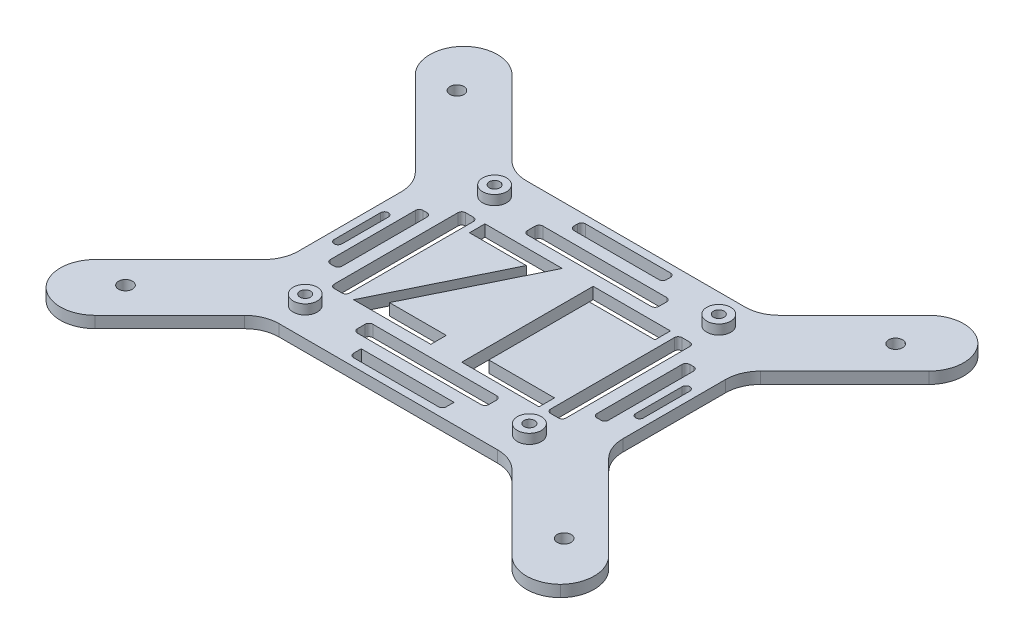
from build123d import *

# Parameters (mm, degrees)
SKETCH2_W           = 84
SKETCH2_H           = 64
BOSS_EXTRUDE1_DEPTH = 3
SKETCH3_R           = 3.1
BOSS_EXTRUDE2_DEPTH = 2.5
SKETCH4_R           = 1.375
CUT_EXTRUDE1_DEPTH  = 95.667806042
SKETCH5_R           = 1.8
CUT_EXTRUDE2_DEPTH  = 95.555504868
FILLET1_R           = 9
FILLET2_R           = 9
CUT_EXTRUDE3_DEPTH  = 90.310693627
SKETCH7_W           = 2
SKETCH7_H           = 14
SKETCH7_W_2         = 3
SKETCH7_H_2         = 24
SKETCH7_W_3         = 4
SKETCH7_H_3         = 34
SKETCH7_W_4         = 24
SKETCH7_H_4         = 3
SKETCH7_W_5         = 34
SKETCH7_H_5         = 4
CUT_EXTRUDE4_DEPTH  = 90.310693627
FILLET3_R           = 1


# Some blends are built 0.0001 mm under size
with BuildPart() as part:
    # Sketch2 → Boss-Extrude1 (new body)
    with BuildSketch(Plane(origin=(0, 0, 0), x_dir=(1, 0, 0), z_dir=(0, 1, 0))):
        Rectangle(SKETCH2_W, SKETCH2_H)
        Polygon((-42, -32), (-42, -17), (-72.784271247, -47.784271247), (-60.284271247, -60.284271247), (-32, -32), align=None)
        Polygon((60.284271247, 60.284271247), (32, 32), (42, 32), (42, 17), (72.784271247, 47.784271247), align=None)
        Polygon((72.784271247, -47.784271247), (42, -17), (42, -32), (32, -32), (60.284271247, -60.284271247), align=None)
        Polygon((-42, 32), (-32, 32), (-60.284271247, 60.284271247), (-72.784271247, 47.784271247), (-42, 17), align=None)
    extrude(amount=BOSS_EXTRUDE1_DEPTH)

    # Sketch3 → Boss-Extrude2 (add)
    with BuildSketch(Plane(origin=(0, 3, 0), x_dir=(1, 0, 0), z_dir=(0, 1, 0))):
        with Locations(Location((-29, 24.5, 0), (0, 0, 270))):
            Circle(SKETCH3_R)
        with Locations(Location((-29, -24.5, 0), (0, 0, 270))):
            Circle(SKETCH3_R)
        with Locations(Location((29, -24.5, 0), (0, 0, 270))):
            Circle(SKETCH3_R)
        with Locations(Location((29, 24.5, 0), (0, 0, 270))):
            Circle(SKETCH3_R)
    extrude(amount=BOSS_EXTRUDE2_DEPTH)

    # Sketch4 → Cut-Extrude1 (cut, through all)
    with BuildSketch(Plane(origin=(0, 5.5, 0), x_dir=(1, 0, 0), z_dir=(0, 1, 0))):
        with Locations(Location((-29, 24.5, 0), (0, 0, 270))):
            Circle(SKETCH4_R)
        with Locations(Location((-29, -24.5, 0), (0, 0, 270))):
            Circle(SKETCH4_R)
        with Locations(Location((29, -24.5, 0), (0, 0, 270))):
            Circle(SKETCH4_R)
        with Locations(Location((29, 24.5, 0), (0, 0, 270))):
            Circle(SKETCH4_R)
    extrude(amount=-CUT_EXTRUDE1_DEPTH, mode=Mode.SUBTRACT)

    # Sketch5 → Cut-Extrude2 (cut, through all)
    with BuildSketch(Plane(origin=(0, 3, 0), x_dir=(1, 0, 0), z_dir=(0, 1, 0))):
        with Locations(Location((-57.5, 43.25, 0), (0, 0, 270))):
            Circle(SKETCH5_R)
        with Locations(Location((56, 43.25, 0), (0, 0, 270))):
            Circle(SKETCH5_R)
        with Locations(Location((56.75, -43.25, 0), (0, 0, 270))):
            Circle(SKETCH5_R)
        with Locations(Location((-56.75, -43.25, 0), (0, 0, 270))):
            Circle(SKETCH5_R)
    extrude(amount=-CUT_EXTRUDE2_DEPTH, mode=Mode.SUBTRACT)

    # Fillet1
    # the kernel refuses this fillet: 9 mm, written as the material it takes off along each edge
    with BuildSketch(Plane(origin=(-72.784271247, -22.5, 47.784271247), x_dir=(0.7071067811865487, 0, 0.7071067811865464), z_dir=(0, 1, 0)), Plane(origin=(-60.284271247, -22.5, 60.284271247), x_dir=(0.7071067811865467, 0, -0.7071067811865483), z_dir=(0, 1, 0)), Plane(origin=(60.284271247, -22.5, 60.284271247), x_dir=(0.7071067811865482, 0, -0.7071067811865467), z_dir=(0, 1, 0)), Plane(origin=(72.784271247, -22.5, 47.784271247), x_dir=(-0.7071067811865468, 0, -0.7071067811865483), z_dir=(0, 1, 0))) as fillet1_piece_1:
        with BuildLine():
            CenterArc((FILLET1_R, FILLET1_R), FILLET1_R, 180, 90)
            Line((0, FILLET1_R), (0, 0))
            Line((0, 0), (FILLET1_R, 0))
        make_face()
    extrude(amount=48, mode=Mode.SUBTRACT)
    with BuildSketch(Plane(origin=(72.784271247, -22.5, -47.784271247), x_dir=(-0.7071067811865472, 0, 0.707106781186548), z_dir=(0, 1, 0)), Plane(origin=(60.284271247, -22.5, -60.284271247), x_dir=(0.7071067811865487, 0, 0.7071067811865464), z_dir=(0, 1, 0)), Plane(origin=(-60.284271247, -22.5, -60.284271247), x_dir=(0.7071067811865467, 0, 0.7071067811865482), z_dir=(0, 1, 0)), Plane(origin=(-72.784271247, -22.5, -47.784271247), x_dir=(0.7071067811865491, 0, -0.7071067811865459), z_dir=(0, 1, 0))) as fillet1_piece_2:
        with BuildLine():
            CenterArc((FILLET1_R, -FILLET1_R), FILLET1_R, 90, 90)
            Line((0, -FILLET1_R), (0, 0))
            Line((0, 0), (FILLET1_R, 0))
        make_face()
    extrude(amount=48, mode=Mode.SUBTRACT)

    # Fillet2
    fillet2_edges = [part.edges().sort_by_distance(p)[0] for p in [
        (42, 1.5, 17),
        (32, 1.5, 32),
        (-32, 1.5, 32),
        (-42, 1.5, 17),
        (-42, 1.5, -17),
        (-32, 1.5, -32),
        (32, 1.5, -32),
        (42, 1.5, -17),
    ]]
    fillet(fillet2_edges, radius=FILLET2_R)

    # Sketch6 → Cut-Extrude3 (cut, through all)
    with BuildSketch(Plane(origin=(0, 3, 0), x_dir=(1, 0, 0), z_dir=(0, 1, 0))):
        Polygon((-24, 17), (-4, 17), (-18.699326173, -13), (-4, -13), (-4, -17), (-24, -17), (-9.300673827, 13), (-24, 13), align=None)
        Polygon((7, 13), (24, 13), (24, 17), (4, 17), (4, -17), (24, -17), (24, -13), (7, -13), align=None)
    extrude(amount=-CUT_EXTRUDE3_DEPTH, mode=Mode.SUBTRACT)

    # Sketch7 → Cut-Extrude4 (cut, through all)
    with BuildSketch(Plane(origin=(0, 3, 0), x_dir=(1, 0, 0), z_dir=(0, 1, 0))):
        with Locations((-39, 0)):
            Rectangle(SKETCH7_W, SKETCH7_H)
        with Locations((-34.5, 0)):
            Rectangle(SKETCH7_W_2, SKETCH7_H_2)
        with Locations((-28, 0)):
            Rectangle(SKETCH7_W_3, SKETCH7_H_3)
        with Locations((0, 28.5)):
            Rectangle(SKETCH7_W_4, SKETCH7_H_4)
        with Locations((0, 22)):
            Rectangle(SKETCH7_W_5, SKETCH7_H_5)
        with Locations((0, -22)):
            Rectangle(SKETCH7_W_5, SKETCH7_H_5)
        with Locations((0, -28.5)):
            Rectangle(SKETCH7_W_4, SKETCH7_H_4)
        with Locations((28, 0)):
            Rectangle(SKETCH7_W_3, SKETCH7_H_3)
        with Locations((34.5, 0)):
            Rectangle(SKETCH7_W_2, SKETCH7_H_2)
        with Locations((39, 0)):
            Rectangle(SKETCH7_W, SKETCH7_H)
    extrude(amount=-CUT_EXTRUDE4_DEPTH, mode=Mode.SUBTRACT)

    # Fillet3
    fillet3_edges = [part.edges().sort_by_distance(p)[0] for p in [
        (-12, 1.5, -27),
        (12, 1.5, -27),
        (17, 1.5, -20),
        (-17, 1.5, -20),
        (-17, 1.5, -24),
        (17, 1.5, -24),
        (12, 1.5, -30),
        (-12, 1.5, -30),
        (-17, 1.5, 20),
        (17, 1.5, 20),
        (17, 1.5, 24),
        (12, 1.5, 30),
        (-12, 1.5, 30),
        (-17, 1.5, 24),
        (30, 1.5, 17),
        (36, 1.5, 12),
        (40, 1.5, 7),
        (38, 1.5, 7),
        (33, 1.5, 12),
        (26, 1.5, 17),
        (26, 1.5, -17),
        (33, 1.5, -12),
        (38, 1.5, -7),
        (30, 1.5, -17),
        (36, 1.5, -12),
        (40, 1.5, -7),
        (-30, 1.5, 17),
        (-26, 1.5, 17),
        (-30, 1.5, -17),
        (-26, 1.5, -17),
        (-33, 1.5, -12),
        (-36, 1.5, -12),
        (-33, 1.5, 12),
        (-36, 1.5, 12),
        (-38, 1.5, 7),
        (-40, 1.5, 7),
        (-38, 1.5, -7),
        (-40, 1.5, -7),
    ]]
    fillet(fillet3_edges, radius=FILLET3_R - 0.0001)  # a hair under: the kernel refuses the full size


solid = part.part
